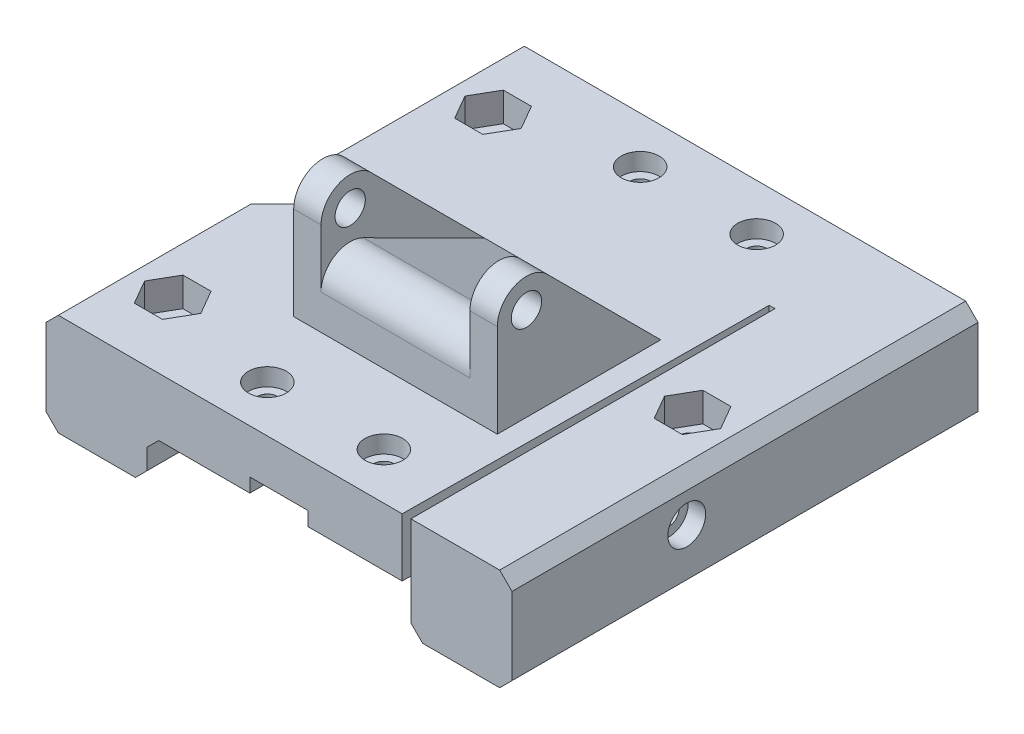
from build123d import *

# Parameters (mm, degrees)
BOSS_EXTRUDE1_DEPTH = 80
SKETCH2_R           = 2.6
CUT_EXTRUDE1_DEPTH  = 325.340177974
SKETCH7_W           = 1.9
SKETCH7_H           = 5.75
CUT_EXTRUDE5_DEPTH  = 5.75
SKETCH9_W           = 10
SKETCH9_H           = 20
CUT_EXTRUDE6_DEPTH  = 2.4
CUT_EXTRUDE7_START  = -9.999995
SKETCH11_R          = 1.75
CUT_EXTRUDE7_DEPTH  = 9.999995
SKETCH13_R          = 3.25
CUT_EXTRUDE8_DEPTH  = 3
SKETCH15_R          = 2.6
BOSS_EXTRUDE7_DEPTH = 80
CUT_EXTRUDE12_DEPTH = 5
SKETCH5_R           = 3.25
CUT_EXTRUDE22_DEPTH = 3
SKETCH30_R          = 1.675
CUT_EXTRUDE23_DEPTH = 25
CUT_EXTRUDE34_DEPTH = 326.347016047
BOSS_EXTRUDE5_DEPTH = 17.5
SKETCH16_W          = 25.561
SKETCH16_H          = 23.4499
SKETCH16_W_2        = 23.8489
CUT_EXTRUDE35_DEPTH = 359.746594886
SKETCH38_W          = 6
SKETCH38_H          = 17.5
CUT_EXTRUDE36_DEPTH = 6
CHAMFER1_SIZE       = 6
CHAMFER2_SIZE       = 6
SKETCH37_R          = 1.6
CUT_EXTRUDE29_DEPTH = 25
BOSS_EXTRUDE8_DEPTH = 30.261


with BuildPart() as part:
    # Sketch1 → Boss-Extrude1 (new body)
    with BuildSketch(Plane.XY):
        Polygon((253.183144434, 132.132101078), (251.183144434, 130.132101078), (251.183144434, 126.632096278), (249.183144434, 124.632096278), (235.948217796, 124.632096278), (233.831644434, 126.74866964), (233.831644434, 140.015512734), (235.948217796, 142.132096278), (311.715071072, 142.132096278), (313.831644434, 140.015522917), (313.831644434, 126.74866964), (311.715071072, 124.632096278), (298.480144434, 124.632096278), (296.480144434, 126.632096278), (296.480144434, 132.132101078), align=None)
    extrude(amount=BOSS_EXTRUDE1_DEPTH)

    # Sketch2 → Cut-Extrude1 (cut, through all)
    with BuildSketch(Plane(origin=(0, 142.132096278, 0), x_dir=(1, 0, 0), z_dir=(0, 1, 0))):
        with Locations(Location((243.081644434, -12.5, 0), (0, 0, 270))):
            Circle(SKETCH2_R)
        with Locations(Location((304.581644434, -40, 0), (0, 0, 270))):
            Circle(SKETCH2_R)
        with Locations(Location((243.081644434, -67.5, 0), (0, 0, 90))):
            Circle(SKETCH2_R)
    extrude(amount=-CUT_EXTRUDE1_DEPTH, mode=Mode.SUBTRACT)

    # Sketch7 → Cut-Extrude5 (cut)
    with BuildSketch(Plane.XZ.offset(-132.132101078)):
        with Locations((290.530144434, 50)):
            Rectangle(SKETCH7_W, SKETCH7_H)
        with Locations((257.133644434, 40)):
            Rectangle(SKETCH7_W, SKETCH7_H)
    extrude(amount=-CUT_EXTRUDE5_DEPTH, mode=Mode.SUBTRACT)

    # Sketch9 → Cut-Extrude6 (cut)
    with BuildSketch(Plane.XZ.offset(-132.132101078)):
        with Locations((273.831644434, 70)):
            Rectangle(SKETCH9_W, SKETCH9_H)
        with Locations((273.831644434, 10)):
            Rectangle(SKETCH9_W, SKETCH9_H)
    extrude(amount=-CUT_EXTRUDE6_DEPTH, mode=Mode.SUBTRACT)

    # Sketch11 → Cut-Extrude7 (cut)
    with BuildSketch(Plane.XZ.offset(-132.132101078).offset(CUT_EXTRUDE7_START)):
        with Locations((263.831644434, 72)):
            Circle(SKETCH11_R)
        with Locations(Location((283.831644434, 72, 0), (0, 0, 180))):
            Circle(SKETCH11_R)
        with Locations((283.831644434, 8)):
            Circle(SKETCH11_R)
        with Locations(Location((263.831644434, 8, 0), (0, 0, 180))):
            Circle(SKETCH11_R)
    extrude(amount=CUT_EXTRUDE7_DEPTH, mode=Mode.SUBTRACT)

    # Sketch13 → Cut-Extrude8 (cut)
    with BuildSketch(Plane(origin=(0, 142.132096278, 0), x_dir=(1, 0, 0), z_dir=(0, 1, 0))):
        with Locations(Location((263.831644434, -8, 0), (0, 0, 270))):
            Circle(SKETCH13_R)
        with Locations(Location((283.831644434, -8, 0), (0, 0, 90))):
            Circle(SKETCH13_R)
        with Locations(Location((283.831644434, -72, 0), (0, 0, 270))):
            Circle(SKETCH13_R)
        with Locations(Location((263.831644434, -72, 0), (0, 0, 90))):
            Circle(SKETCH13_R)
    extrude(amount=-CUT_EXTRUDE8_DEPTH, mode=Mode.SUBTRACT)

    # Sketch15 → Boss-Extrude7 (add, through all)
    with BuildSketch(Plane.ZY.offset(-233.831644434)):
        with BuildLine():
            Line((31.938932188, 142.132096278), (60, 142.132096278))
            Line((60, 142.132096278), (60, 158.122096278))
            ThreePointArc((60, 158.122096278), (56.913417162, 162.741493941), (51.464466094, 161.657630184))
            Line((51.464466094, 161.657630184), (31.938932188, 142.132096278))
        make_face()
        with Locations((55, 158.122096278)):
            Circle(SKETCH15_R, mode=Mode.SUBTRACT)
    extrude(amount=-BOSS_EXTRUDE7_DEPTH)

    # Sketch19 → Cut-Extrude12 (cut)
    with BuildSketch(Plane(origin=(0, 142.132096278, 0), x_dir=(1, 0, 0), z_dir=(0, 1, 0))):
        Polygon((238.260769686, -12.5), (240.67120706, -16.675), (245.492081808, -16.675), (247.902519182, -12.5), (245.492081808, -8.325), (240.67120706, -8.325), align=None)
        Polygon((300.010769686, -40), (302.42120706, -44.175), (307.242081808, -44.175), (309.652519182, -40), (307.242081808, -35.825), (302.42120706, -35.825), align=None)
        Polygon((240.67120706, -71.675), (238.260769686, -67.5), (240.67120706, -63.325), (245.492081808, -63.325), (247.902519182, -67.5), (245.492081808, -71.675), align=None)
    extrude(amount=-CUT_EXTRUDE12_DEPTH, mode=Mode.SUBTRACT)

    # Sketch5 → Cut-Extrude22 (cut)
    with BuildSketch(Plane(origin=(313.831644434, 0, 0), x_dir=(0, 0, -1), z_dir=(1, 0, 0))):
        with Locations(Location((-50, 134.901522917, 0), (0, 0, 90))):
            Circle(SKETCH5_R)
    extrude(amount=-CUT_EXTRUDE22_DEPTH, mode=Mode.SUBTRACT)

    # Sketch30 → Cut-Extrude23 (cut)
    with BuildSketch(Plane(origin=(310.831644434, 0, 0), x_dir=(0, 0, -1), z_dir=(1, 0, 0))):
        with Locations(Location((-50, 134.901522917, 0), (0, 0, 90))):
            Circle(SKETCH30_R)
    extrude(amount=-CUT_EXTRUDE23_DEPTH, mode=Mode.SUBTRACT)

    # Sketch3 → Cut-Extrude34 (cut, through all)
    with BuildSketch(Plane.XZ.offset(-132.132101078)):
        Polygon((296.48017643, 80), (294.98017643, 80), (295.480144434, 17.507999488), (296.480144434, 17.5), align=None)
    extrude(amount=-CUT_EXTRUDE34_DEPTH, mode=Mode.SUBTRACT)

    # Sketch31 → Boss-Extrude5 (add)
    with BuildSketch(Plane(origin=(0, 0, 0), x_dir=(-1, 0, 0), z_dir=(0, 0, -1))):
        Polygon((-296.480144434, 132.132101078), (-296.480144434, 130.132101078), (-294.480144434, 132.132101078), align=None)
    extrude(amount=-BOSS_EXTRUDE5_DEPTH)

    # Sketch16 → Cut-Extrude35 (cut, through all)
    with BuildSketch(Plane.XY.offset(60)):
        with Locations((273.831644434, 153.857046278)):
            Rectangle(SKETCH16_W, SKETCH16_H)
        with Locations((244.426694434, 153.857046278)):
            Rectangle(SKETCH16_W_2, SKETCH16_H)
        with Locations((303.236594434, 153.857046278)):
            Rectangle(SKETCH16_W_2, SKETCH16_H)
    extrude(amount=-CUT_EXTRUDE35_DEPTH, mode=Mode.SUBTRACT)

    # Sketch38 → Cut-Extrude36 (cut)
    with BuildSketch(Plane.ZY.offset(-233.831644434)):
        with Locations((40, 133.382096278)):
            Rectangle(SKETCH38_W, SKETCH38_H)
    extrude(amount=-CUT_EXTRUDE36_DEPTH, mode=Mode.SUBTRACT)

    # Chamfer1
    chamfer1_edges = [part.edges().sort_by_distance(p)[0] for p in [
        (233.831644434, 133.382091187, 43),
    ]]
    chamfer(chamfer1_edges, length=CHAMFER1_SIZE - 0.0001)  # a hair under: the kernel refuses the full size

    # Chamfer2
    chamfer2_edges = [part.edges().sort_by_distance(p)[0] for p in [
        (233.831644434, 133.382091187, 37),
    ]]
    chamfer(chamfer2_edges, length=CHAMFER2_SIZE - 0.0001)  # a hair under: the kernel refuses the full size

    # Sketch37 → Cut-Extrude29 (cut)
    with BuildSketch(Plane.ZY.offset(-239.831644434)):
        with Locations((40, 134.901396278)):
            Circle(SKETCH37_R)
    extrude(amount=-CUT_EXTRUDE29_DEPTH, mode=Mode.SUBTRACT)

    # Sketch39 → Boss-Extrude8 (add)
    with BuildSketch(Plane.ZY.offset(-256.351144434)):
        with BuildLine():
            Line((52.755415069, 152.589963609), (31.938932188, 142.132096278))
            Line((31.938932188, 142.132096278), (60, 142.132096278))
            Line((60, 142.132096278), (60, 148.122096278))
            ThreePointArc((60, 148.122096278), (57.624602384, 152.377852654), (52.755415069, 152.589963609))
        make_face()
    extrude(amount=-BOSS_EXTRUDE8_DEPTH)


solid = part.part
